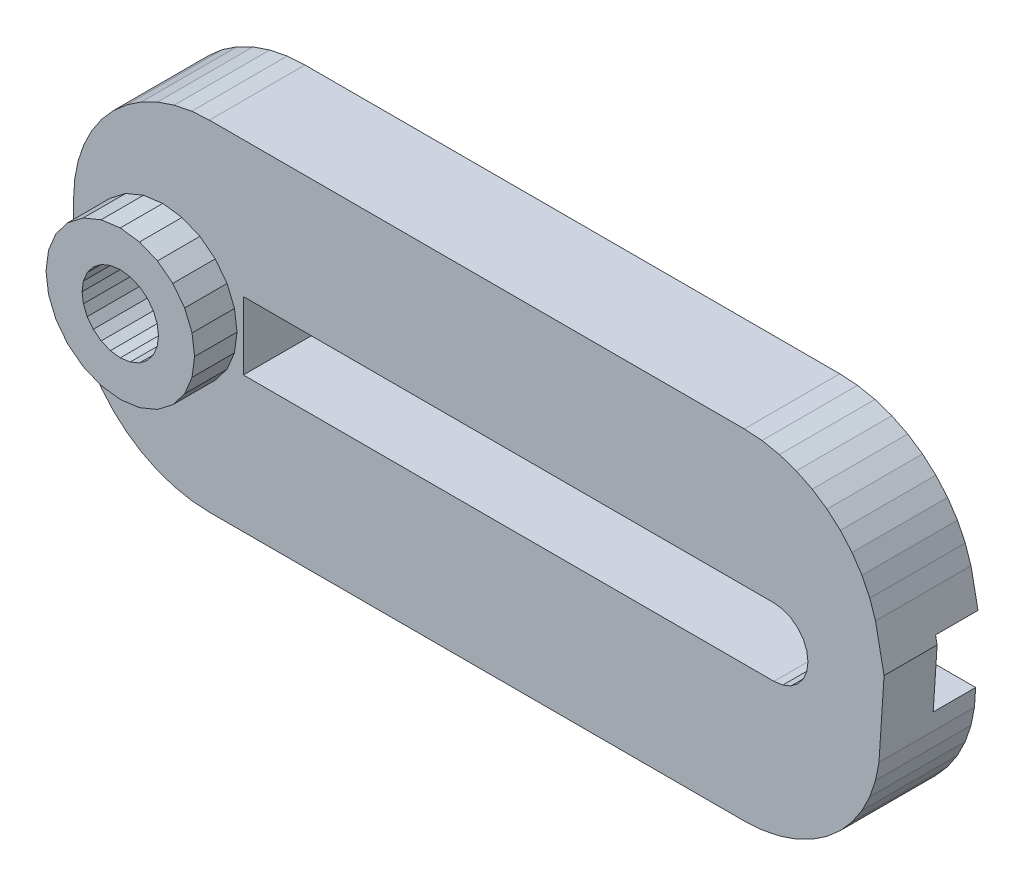
from build123d import *

# Parameters (mm, degrees)
BOSS_EXTRUDE1_DEPTH = 4.5
CUT_EXTRUDE1_DEPTH  = 2.5
CUT_EXTRUDE2_DEPTH  = 0.414110472
CUT_EXTRUDE3_DEPTH  = 0.414110472
CUT_EXTRUDE4_DEPTH  = 0.385889528
CUT_EXTRUDE5_DEPTH  = 0.385889528
CUT_EXTRUDE6_DEPTH  = 0.33137085
CUT_EXTRUDE7_DEPTH  = 0.33137085
CUT_EXTRUDE8_DEPTH  = 0.254269796
SKETCH10_W          = 5
SKETCH10_H          = 2
CUT_EXTRUDE9_DEPTH  = 0.214359354
CUT_EXTRUDE10_DEPTH = 0.254269796
SKETCH12_W          = 5
SKETCH12_H          = 2
CUT_EXTRUDE11_DEPTH = 0.214359354
SKETCH13_W          = 4.5
SKETCH13_H          = 3.2
CUT_EXTRUDE12_DEPTH = 25
BOSS_EXTRUDE2_DEPTH = 2
CUT_EXTRUDE13_DEPTH = 39.14773912
DRAFT1_START        = -2
DRAFT1_DEPTH        = 4.5
DRAFT1_2_DEPTH      = 2.5
DRAFT1_3_DEPTH      = 2


# Read off the part's stored shape, not the designer's step: Draft1
with BuildPart() as part:
    # Sketch1 → Boss-Extrude1 (new body)
    with BuildSketch(Plane(origin=(0, 0, -2), x_dir=(-1, 0, 0), z_dir=(0, 0, -1))):
        Polygon((-33, 12.160106278), (-33, 7.839893722), (-32.781925288, 6.743558111), (-32.512829008, 5.950826033), (-32.142562584, 5.2), (-31.677461378, 4.503926854), (-31.1254834, 3.8745166), (-30.496073146, 3.322538622), (-29.8, 2.857437416), (-29.049173967, 2.487170992), (-28.256441889, 2.218074712), (-27.43536763, 2.054752887), (-26.6, 2), (-1.4, 2), (-0.56463237, 2.054752887), (0.256441889, 2.218074712), (1.049173967, 2.487170992), (1.8, 2.857437416), (2.496073146, 3.322538622), (3.1254834, 3.8745166), (3.677461378, 4.503926854), (4.142562584, 5.2), (4.512829008, 5.950826033), (4.781925288, 6.743558111), (4.945247113, 7.56463237), (5, 8.4), (5, 11.6), (4.945247113, 12.43536763), (4.781925288, 13.256441889), (4.512829008, 14.049173967), (4.142562584, 14.8), (3.677461378, 15.496073146), (3.1254834, 16.1254834), (2.496073146, 16.677461378), (1.8, 17.142562584), (1.049173967, 17.512829008), (0.256441889, 17.781925288), (-0.56463237, 17.945247113), (-1.4, 18), (-26.6, 18), (-27.43536763, 17.945247113), (-28.256441889, 17.781925288), (-29.049173967, 17.512829008), (-29.8, 17.142562584), (-30.496073146, 16.677461378), (-31.1254834, 16.1254834), (-31.677461378, 15.496073146), (-32.142562584, 14.8), (-32.512829008, 14.049173967), (-32.781925288, 13.256441889), align=None)
    extrude(amount=-BOSS_EXTRUDE1_DEPTH)

    # Sketch2 → Cut-Extrude1 (cut)
    with BuildSketch(Plane.XY.offset(2.5)):
        Polygon((29.6, 10), (29.545481322, 10.414110472), (29.385640646, 10.8), (29.13137085, 11.13137085), (28.8, 11.385640646), (28.414110472, 11.545481322), (28, 11.6), (28, 8.4), (28.414110472, 8.454518678), (28.8, 8.614359354), (29.13137085, 8.86862915), (29.385640646, 9.2), (29.545481322, 9.585889528), align=None)
    extrude(amount=-CUT_EXTRUDE1_DEPTH, mode=Mode.SUBTRACT)

    # Sketch3 → Cut-Extrude2 (cut)
    with BuildSketch(Plane.XZ.offset(-10)):
        Polygon((28, 0), (28, -2), (33, -2), (33, 0), (29.545481322, 0), align=None)
    extrude(amount=-CUT_EXTRUDE2_DEPTH, mode=Mode.SUBTRACT)

    # Sketch4 → Cut-Extrude3 (cut)
    with BuildSketch(Plane(origin=(0, 10, 0), x_dir=(-1, 0, 0), z_dir=(0, 1, 0))):
        Polygon((-28, -2), (-28, 0), (-29.545481322, 0), (-33, 0), (-33, -2), align=None)
    extrude(amount=-CUT_EXTRUDE3_DEPTH, mode=Mode.SUBTRACT)

    # Sketch5 → Cut-Extrude4 (cut)
    with BuildSketch(Plane.XZ.offset(-10.414110472)):
        Polygon((28, 0), (28, -2), (33, -2), (33, 0), (29.385640646, 0), align=None)
    extrude(amount=-CUT_EXTRUDE4_DEPTH, mode=Mode.SUBTRACT)

    # Sketch6 → Cut-Extrude5 (cut)
    with BuildSketch(Plane(origin=(0, 9.585889528, 0), x_dir=(-1, 0, 0), z_dir=(0, 1, 0))):
        Polygon((-28, -2), (-28, 0), (-29.385640646, 0), (-33, 0), (-33, -2), align=None)
    extrude(amount=-CUT_EXTRUDE5_DEPTH, mode=Mode.SUBTRACT)

    # Sketch7 → Cut-Extrude6 (cut)
    with BuildSketch(Plane.XZ.offset(-10.8)):
        Polygon((28, 0), (28, -2), (33, -2), (33, 0), (29.13137085, 0), align=None)
    extrude(amount=-CUT_EXTRUDE6_DEPTH, mode=Mode.SUBTRACT)

    # Sketch8 → Cut-Extrude7 (cut)
    with BuildSketch(Plane(origin=(0, 9.2, 0), x_dir=(-1, 0, 0), z_dir=(0, 1, 0))):
        Polygon((-28, -2), (-28, 0), (-29.13137085, 0), (-33, 0), (-33, -2), align=None)
    extrude(amount=-CUT_EXTRUDE7_DEPTH, mode=Mode.SUBTRACT)

    # Sketch9 → Cut-Extrude8 (cut)
    with BuildSketch(Plane.XZ.offset(-11.13137085)):
        Polygon((28, 0), (28, -2), (33, -2), (33, 0), (28.8, 0), align=None)
    extrude(amount=-CUT_EXTRUDE8_DEPTH, mode=Mode.SUBTRACT)

    # Sketch10 → Cut-Extrude9 (cut)
    with BuildSketch(Plane.XZ.offset(-11.385640646)):
        with Locations((30.5, -1)):
            Rectangle(SKETCH10_W, SKETCH10_H)
    extrude(amount=-CUT_EXTRUDE9_DEPTH, mode=Mode.SUBTRACT)

    # Sketch11 → Cut-Extrude10 (cut)
    with BuildSketch(Plane(origin=(0, 8.86862915, 0), x_dir=(-1, 0, 0), z_dir=(0, 1, 0))):
        Polygon((-28, -2), (-28, 0), (-28.8, 0), (-33, 0), (-33, -2), align=None)
    extrude(amount=-CUT_EXTRUDE10_DEPTH, mode=Mode.SUBTRACT)

    # Sketch12 → Cut-Extrude11 (cut)
    with BuildSketch(Plane(origin=(0, 8.614359354, 0), x_dir=(-1, 0, 0), z_dir=(0, 1, 0))):
        with Locations((-30.5, -1)):
            Rectangle(SKETCH12_W, SKETCH12_H)
    extrude(amount=-CUT_EXTRUDE11_DEPTH, mode=Mode.SUBTRACT)

    # Sketch13 → Cut-Extrude12 (cut)
    with BuildSketch(Plane(origin=(28, 0, 0), x_dir=(0, 0, -1), z_dir=(1, 0, 0))):
        with Locations((-0.25, 10)):
            Rectangle(SKETCH13_W, SKETCH13_H)
    extrude(amount=-CUT_EXTRUDE12_DEPTH, mode=Mode.SUBTRACT)

    # Sketch14 → Boss-Extrude2 (add)
    with BuildSketch(Plane.XY.offset(2.5)):
        Polygon((1.674873734, 12.474873734), (2.231088913, 11.75), (2.580740392, 10.905866658), (2.7, 10), (2.580740392, 9.094133342), (2.231088913, 8.25), (1.674873734, 7.525126266), (0.95, 6.968911087), (0.105866658, 6.619259608), (-0.8, 6.5), (-1.705866658, 6.619259608), (-2.55, 6.968911087), (-3.274873734, 7.525126266), (-3.831088913, 8.25), (-4.180740392, 9.094133342), (-4.3, 10), (-4.180740392, 10.905866658), (-3.831088913, 11.75), (-3.274873734, 12.474873734), (-2.55, 13.031088913), (-1.705866658, 13.380740392), (-0.8, 13.5), (0.105866658, 13.380740392), (0.95, 13.031088913), align=None)
    extrude(amount=BOSS_EXTRUDE2_DEPTH)

    # Sketch15 → Cut-Extrude13 (cut, through all)
    with BuildSketch(Plane(origin=(0, 0, -2), x_dir=(-1, 0, 0), z_dir=(0, 0, -1))):
        Polygon((-0.938666487, 9.534125719), (-0.758845727, 9.1), (-0.472792206, 8.727207794), (-0.1, 8.441154273), (0.334125719, 8.261333513), (0.8, 8.2), (1.265874281, 8.261333513), (1.7, 8.441154273), (2.072792206, 8.727207794), (2.358845727, 9.1), (2.538666487, 9.534125719), (2.6, 10), (2.538666487, 10.465874281), (2.358845727, 10.9), (2.072792206, 11.272792206), (1.7, 11.558845727), (1.265874281, 11.738666487), (0.8, 11.8), (0.334125719, 11.738666487), (-0.1, 11.558845727), (-0.472792206, 11.272792206), (-0.758845727, 10.9), (-0.938666487, 10.465874281), (-1, 10), align=None)
    extrude(amount=-CUT_EXTRUDE13_DEPTH, mode=Mode.SUBTRACT)

    # Draft1 outline → Draft1 (cut)
    with BuildSketch(Plane.XY.offset(DRAFT1_START)):
        Polygon((33, 8.399999998), (32.945247113, 7.56463237), (33, 7.839893722), align=None)
    extrude(amount=DRAFT1_DEPTH, mode=Mode.SUBTRACT)

    # Draft1 2 outline → Draft1 2 (add)
    with BuildSketch(Plane.XY):
        Polygon((33, 8.399999998), (33.185369442, 11.228191161), (33, 12.160106278), align=None)
    extrude(amount=DRAFT1_2_DEPTH)

    # Draft1 3 outline → Draft1 3 (add)
    with BuildSketch(Plane.XY.offset(DRAFT1_START)):
        Polygon((33, 12.160106278), (33, 11.6), (33.111412066, 11.6), align=None)
    extrude(amount=DRAFT1_3_DEPTH)


solid = part.part
